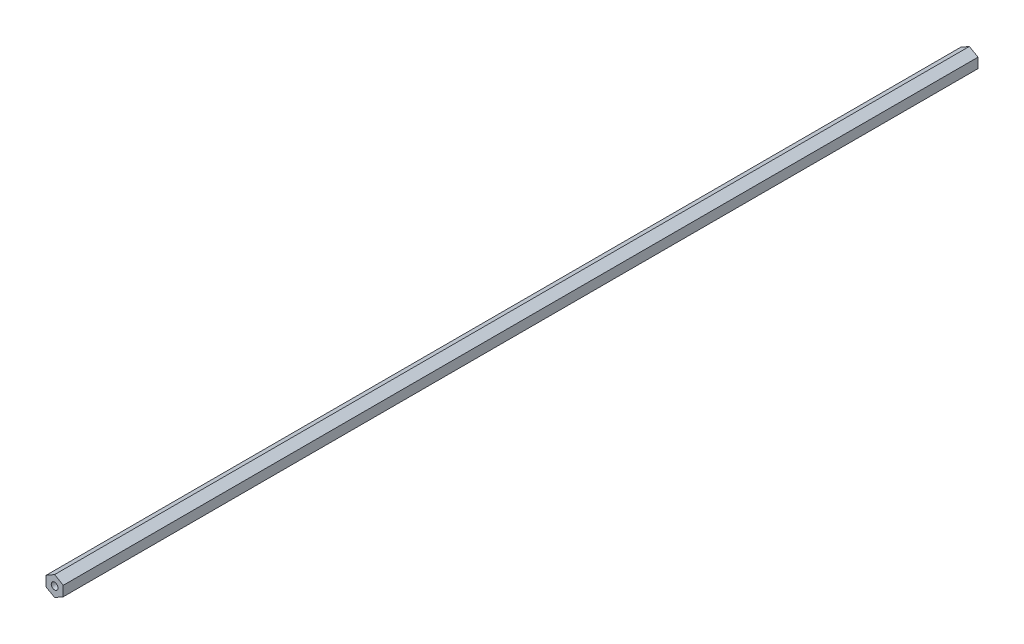
from build123d import *

# Parameters (mm, degrees)
BOSS_EXTRUDE1_DEPTH = 336.80260046
SKETCH2_R           = 2.4892
CUT_EXTRUDE1_DEPTH  = 19.05


with BuildPart() as part:
    # Sketch1 → Boss-Extrude1 (new, symmetric)
    with BuildSketch(Plane.XY):
        Polygon((6.35, -3.666174209), (6.35, 3.666174209), (0, 7.332348419), (-6.35, 3.666174209), (-6.35, -3.666174209), (0, -7.332348419), align=None)
    extrude(amount=BOSS_EXTRUDE1_DEPTH, both=True)

    # Sketch2 → Cut-Extrude1 (cut)
    with BuildSketch(Plane.XY.offset(336.80260046)):
        Circle(SKETCH2_R)
    cut_extrude1 = extrude(amount=-CUT_EXTRUDE1_DEPTH, mode=Mode.SUBTRACT)

    # Mirror1: Cut-Extrude1 across plane
    add(cut_extrude1.mirror(Plane.XY), mode=Mode.SUBTRACT)


solid = part.part
